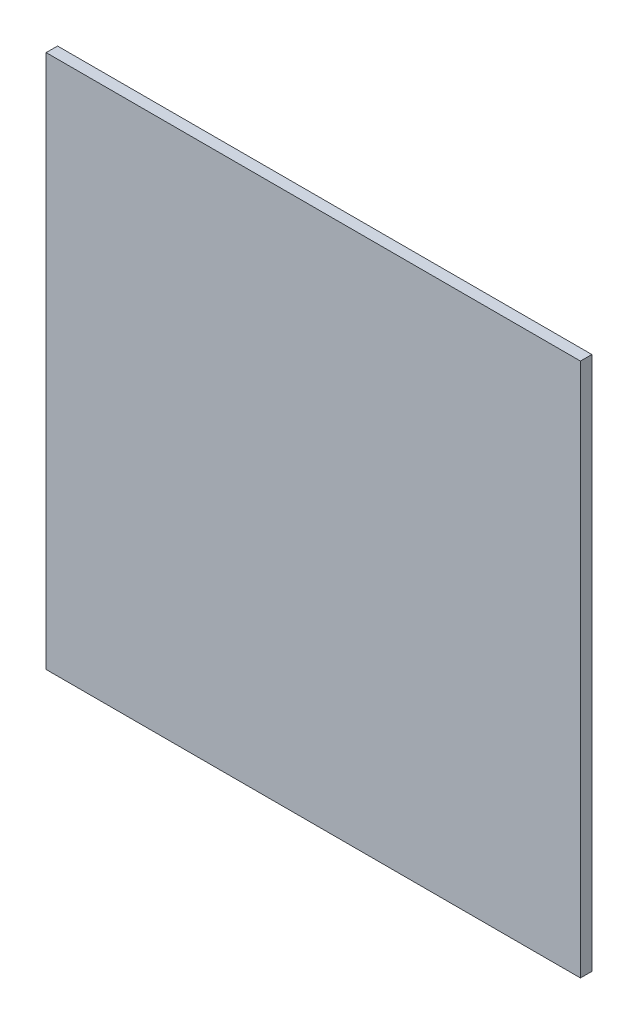
from build123d import *

# Parameters (mm, degrees)
SKETCH1_W           = 75
SKETCH1_H           = 75
BOSS_EXTRUDE1_DEPTH = 1.6


with BuildPart() as part:
    # Sketch1 → Boss-Extrude1 (new body)
    with BuildSketch(Plane.XY):
        Rectangle(SKETCH1_W, SKETCH1_H)
    extrude(amount=BOSS_EXTRUDE1_DEPTH)


solid = part.part
